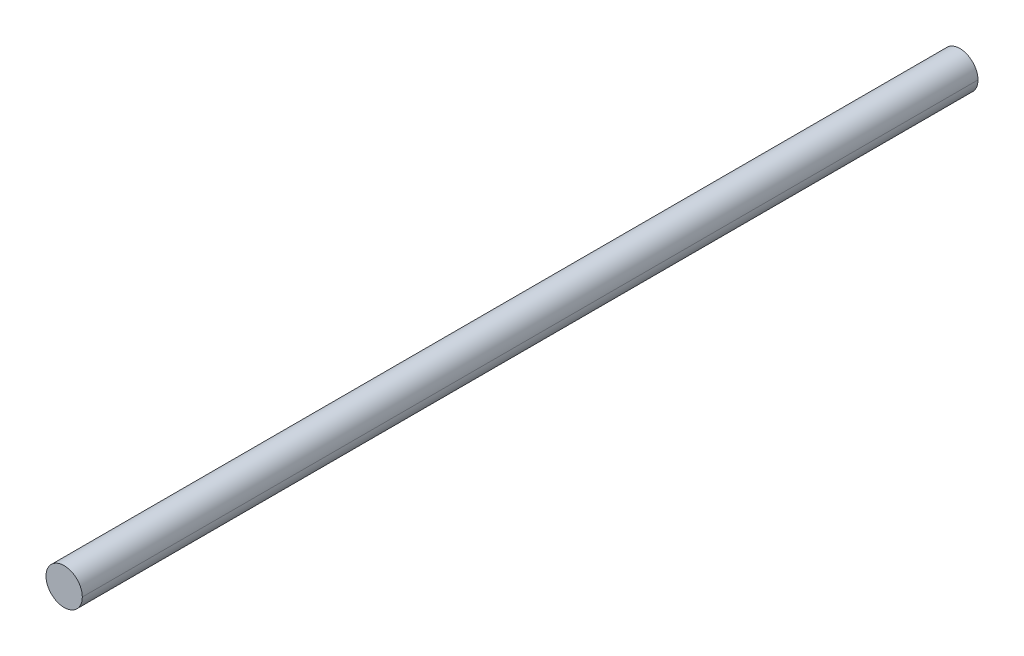
from build123d import *

# Parameters (mm, degrees)
SKETCH_1_R      = 5
EXTRUDE_1_DEPTH = 218.44
EXTRUDE_START   = 28.36
SKETCH_3_R      = 5
EXTRUDE_2_DEPTH = 28.36


with BuildPart() as part:
    # 스케치1 → 보스-돌출1 (new body)
    with BuildSketch(Plane.XY):
        Circle(SKETCH_1_R)
    extrude(amount=EXTRUDE_1_DEPTH)

    # 스케치3 → 보스-돌출2 (add)
    with BuildSketch(Plane(origin=(0, 0, 0), x_dir=(-1, 0, 0), z_dir=(0, 0, -1)).offset(EXTRUDE_START)):
        Circle(SKETCH_3_R)
    extrude(amount=-EXTRUDE_2_DEPTH)


solid = part.part
